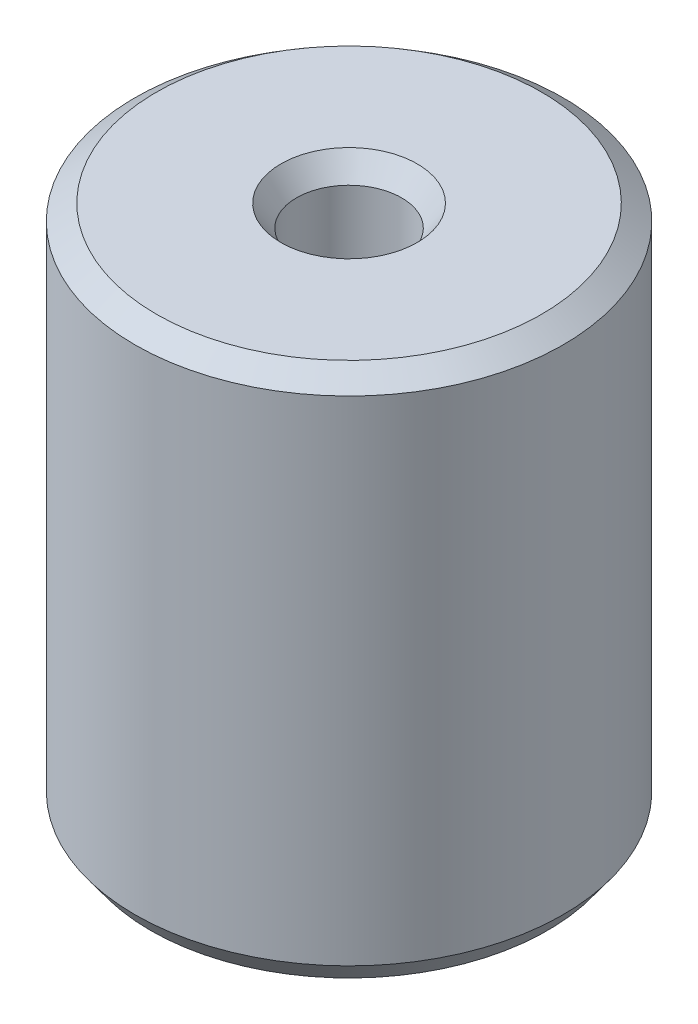
from build123d import *
from OCP.BRepFilletAPI import BRepFilletAPI_MakeChamfer

# Parameters (mm, degrees)
SKETCH1_R           = 5
BOSS_EXTRUDE1_DEPTH = 12.3946018
SKETCH2_R           = 1.226762994
CUT_EXTRUDE1_DEPTH  = 15.26976362
CHAMFER1_SIZE       = 0.365669919
CHAMFER1_SIZE2      = 0.503746467


with BuildPart() as part:
    # Sketch1 → Boss-Extrude1 (new body)
    with BuildSketch(Plane(origin=(0, 0, 0), x_dir=(1, 0, 0), z_dir=(0, 1, 0))):
        Circle(SKETCH1_R)
    extrude(amount=BOSS_EXTRUDE1_DEPTH)

    # Sketch2 → Cut-Extrude1 (cut, through all)
    with BuildSketch(Plane(origin=(0, 0, 0), x_dir=(1, 0, 0), z_dir=(0, 1, 0))):
        Circle(SKETCH2_R)
    extrude(amount=CUT_EXTRUDE1_DEPTH, mode=Mode.SUBTRACT)

    # Chamfer1: one chamfer whose edges measure the first distance from different faces: ONE call of the kernel's chamfer builder (chamfer() names one face for all edges)
    chamfer1_edges_1 = [part.edges().sort_by_distance(p)[0] for p in [
        (-1.226762994, 12.3946018, 0),
    ]]
    chamfer1_side_1 = [part.faces().sort_by_distance(p)[0] for p in [
        (-4.858578644, 12.3946018, 0),
    ]]
    chamfer1_edges_2 = [part.edges().sort_by_distance(p)[0] for p in [
        (-1.226762994, 0, 0),
    ]]
    chamfer1_side_2 = [part.faces().sort_by_distance(p)[0] for p in [
        (-1.226762994, 6.1973009, 0),
    ]]
    chamfer1_edges_3 = [part.edges().sort_by_distance(p)[0] for p in [
        (-5, 0, 0),
    ]]
    chamfer1_side_3 = [part.faces().sort_by_distance(p)[0] for p in [
        (-4.858578644, 0, 0),
    ]]
    chamfer1_edges_4 = [part.edges().sort_by_distance(p)[0] for p in [
        (-5, 12.3946018, 0),
    ]]
    chamfer1_side_4 = [part.faces().sort_by_distance(p)[0] for p in [
        (-5, 6.1973009, 0),
    ]]
    chamfer1 = BRepFilletAPI_MakeChamfer(part.part.solid().wrapped)
    for e in chamfer1_edges_1:
        chamfer1.Add(CHAMFER1_SIZE, CHAMFER1_SIZE2, e.wrapped, chamfer1_side_1[0].wrapped)  # the first distance lies on this face
    for e in chamfer1_edges_2:
        chamfer1.Add(CHAMFER1_SIZE, CHAMFER1_SIZE2, e.wrapped, chamfer1_side_2[0].wrapped)  # the first distance lies on this face
    for e in chamfer1_edges_3:
        chamfer1.Add(CHAMFER1_SIZE, CHAMFER1_SIZE2, e.wrapped, chamfer1_side_3[0].wrapped)  # the first distance lies on this face
    for e in chamfer1_edges_4:
        chamfer1.Add(CHAMFER1_SIZE, CHAMFER1_SIZE2, e.wrapped, chamfer1_side_4[0].wrapped)  # the first distance lies on this face
    add(Compound.cast(chamfer1.Shape()), mode=Mode.REPLACE)


solid = part.part
